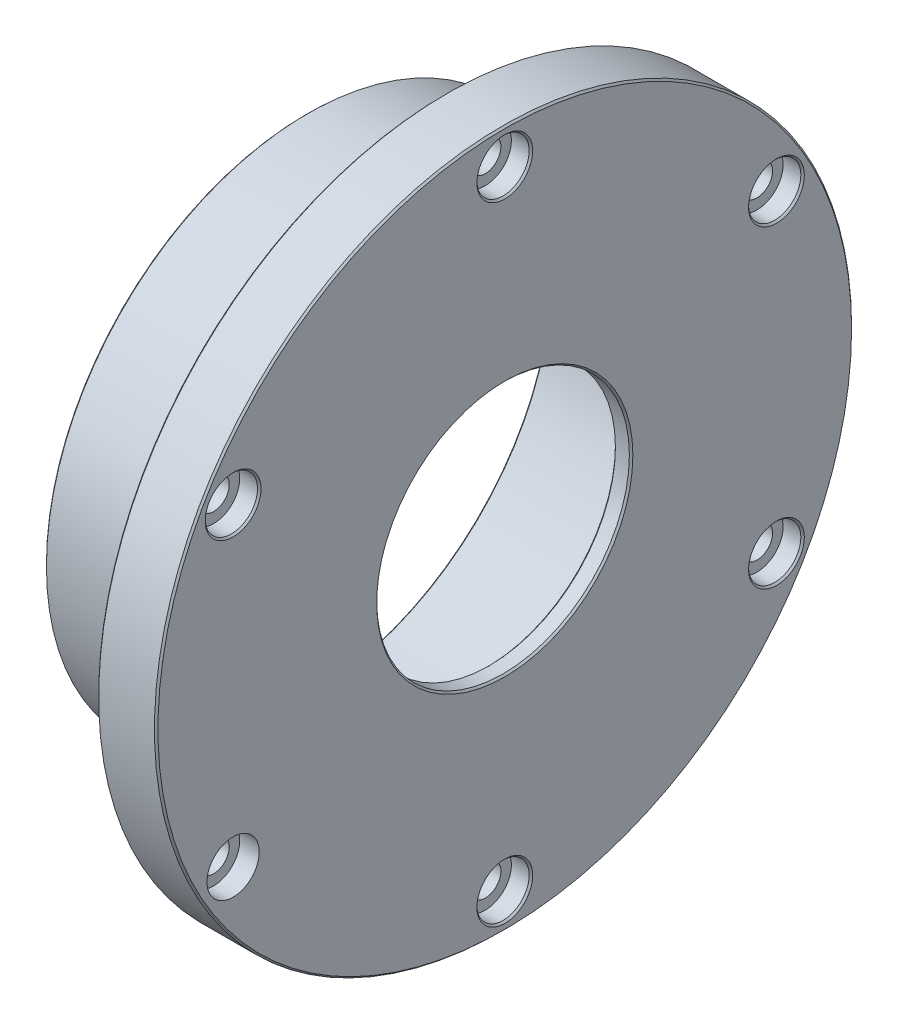
from build123d import *

# Parameters (mm, degrees)
CBORE_FOR_M8_HEX_SOCKET_THIN_HEAD_CAP_SC_D           = 9
CBORE_FOR_M8_HEX_SOCKET_THIN_HEAD_CAP_SC_DEPTH       = 17
CBORE_FOR_M8_HEX_SOCKET_THIN_HEAD_CAP_SC_CBORE_D     = 15
CBORE_FOR_M8_HEX_SOCKET_THIN_HEAD_CAP_SC_CBORE_DEPTH = 5.6
CBORE_FOR_M8_HEX_SOCKET_THIN_HEAD_CAP_SC_TIP         = 2.703872786
CHAMFER1_SIZE                                        = 0.5


with BuildPart() as part:
    # Sketch1 → Revolve1 (revolve)
    with BuildSketch(Plane.XY):
        Polygon((39.938748471, 66.816763283), (22.938748471, 66.816763283), (22.938748471, 41.816763283), (-17.061251529, 41.816763283), (-17.061251529, 36.816763283), (21.938748471, 36.816763283), (21.938748471, 26.816763283), (26.938748471, 26.816763283), (26.938748471, 21.816763283), (34.938748471, 21.816763283), (34.938748471, 3.066763283), (39.938748471, 3.066763283), align=None)
    revolve(axis=Axis((-15.261904536, -33.183236717, 0), (1, 0, 0)))

    # CBORE for M8 Hex Socket Thin Head Cap Screw1
    with Locations(Plane(origin=(39.938748471, 0, 0), x_dir=(0, 0, -1), z_dir=(1, 0, 0))):
        with Locations((77.942286341, 11.816763283), (0, 56.816763283), (0, -33.183236717), (-77.942286341, 11.816763283), (-77.942286341, -78.183236717), (0, -123.183236717), (77.942286341, -78.183236717)):
            CounterBoreHole(CBORE_FOR_M8_HEX_SOCKET_THIN_HEAD_CAP_SC_D / 2, CBORE_FOR_M8_HEX_SOCKET_THIN_HEAD_CAP_SC_CBORE_D / 2, CBORE_FOR_M8_HEX_SOCKET_THIN_HEAD_CAP_SC_CBORE_DEPTH, depth=CBORE_FOR_M8_HEX_SOCKET_THIN_HEAD_CAP_SC_DEPTH)
            with Locations((0, 0, -(CBORE_FOR_M8_HEX_SOCKET_THIN_HEAD_CAP_SC_DEPTH + CBORE_FOR_M8_HEX_SOCKET_THIN_HEAD_CAP_SC_TIP / 2))):  # 118° drill point
                Cone(0, CBORE_FOR_M8_HEX_SOCKET_THIN_HEAD_CAP_SC_D / 2, CBORE_FOR_M8_HEX_SOCKET_THIN_HEAD_CAP_SC_TIP, mode=Mode.SUBTRACT)

    # Chamfer1
    chamfer1_edges = [part.edges().sort_by_distance(p)[0] for p in [
        (22.938748471, -133.183236717, 0),
        (-17.061251529, -108.183236717, 0),
        (22.938748471, -123.183236717, -4.5),
        (22.938748471, -78.183236717, -82.442286341),
        (22.938748471, 11.816763283, -82.442286341),
        (22.938748471, 56.816763283, -4.5),
        (22.938748471, 11.816763283, 73.442286341),
        (22.938748471, -78.183236717, 73.442286341),
        (39.938748471, -123.183236717, 7.5),
        (39.938748471, -78.183236717, -70.442286341),
        (39.938748471, 11.816763283, -70.442286341),
        (39.938748471, 56.816763283, 7.5),
        (39.938748471, 11.816763283, 85.442286341),
        (-17.061251529, -103.183236717, 0),
        (39.938748471, -69.433236717, 0),
        (39.938748471, -133.183236717, 0),
        (34.938748471, -69.433236717, 0),
        (26.938748471, -88.183236717, 0),
        (21.938748471, -93.183236717, 0),
    ]]
    chamfer(chamfer1_edges, length=CHAMFER1_SIZE)


solid = part.part
